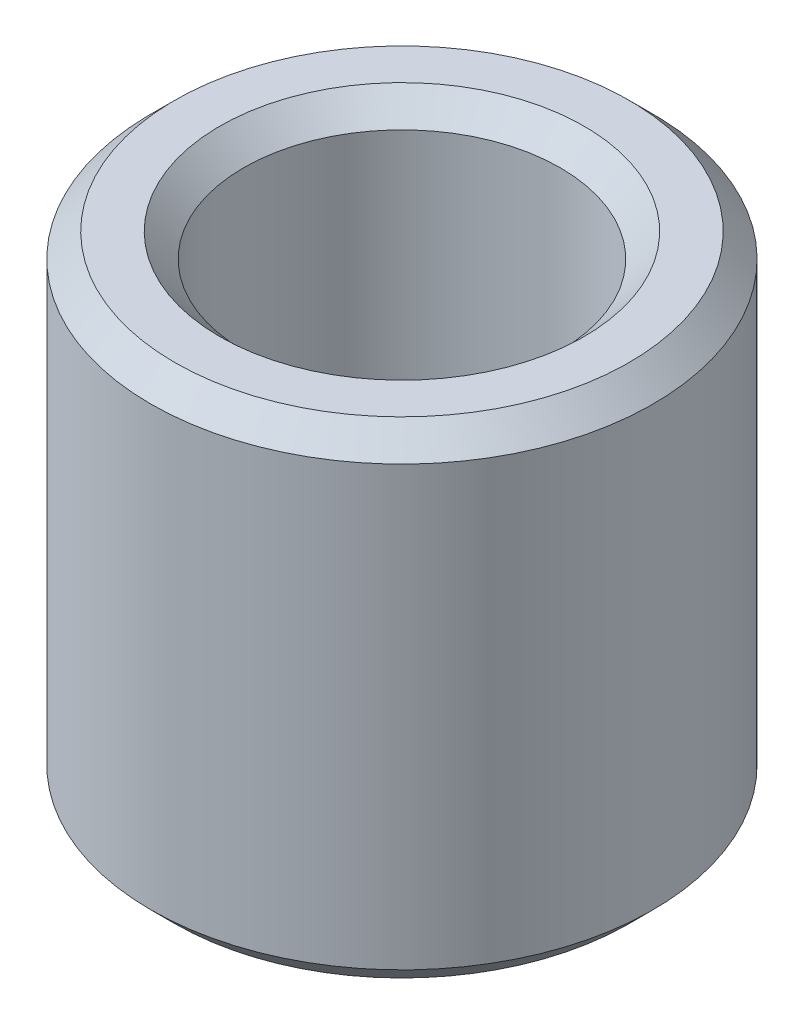
from build123d import *

# Parameters (mm, degrees)
SKETCH1_R           = 7.5
BOSS_EXTRUDE1_DEPTH = 14.513173152
SKETCH2_R           = 4.727021754
CUT_EXTRUDE1_DEPTH  = 18.975878141
CHAMFER1_SIZE       = 0.715792674


with BuildPart() as part:
    # Sketch1 → Boss-Extrude1 (new body)
    with BuildSketch(Plane(origin=(0, 0, 0), x_dir=(1, 0, 0), z_dir=(0, 1, 0))):
        Circle(SKETCH1_R)
    extrude(amount=BOSS_EXTRUDE1_DEPTH)

    # Sketch2 → Cut-Extrude1 (cut, through all)
    with BuildSketch(Plane(origin=(0, 0, 0), x_dir=(1, 0, 0), z_dir=(0, 1, 0))):
        Circle(SKETCH2_R)
    extrude(amount=CUT_EXTRUDE1_DEPTH, mode=Mode.SUBTRACT)

    # Chamfer1
    chamfer1_edges = [part.edges().sort_by_distance(p)[0] for p in [
        (-4.727021754, 14.513173152, 0),
        (-4.727021754, 0, 0),
        (-7.5, 0, 0),
        (-7.5, 14.513173152, 0),
    ]]
    chamfer(chamfer1_edges, length=CHAMFER1_SIZE)


solid = part.part
